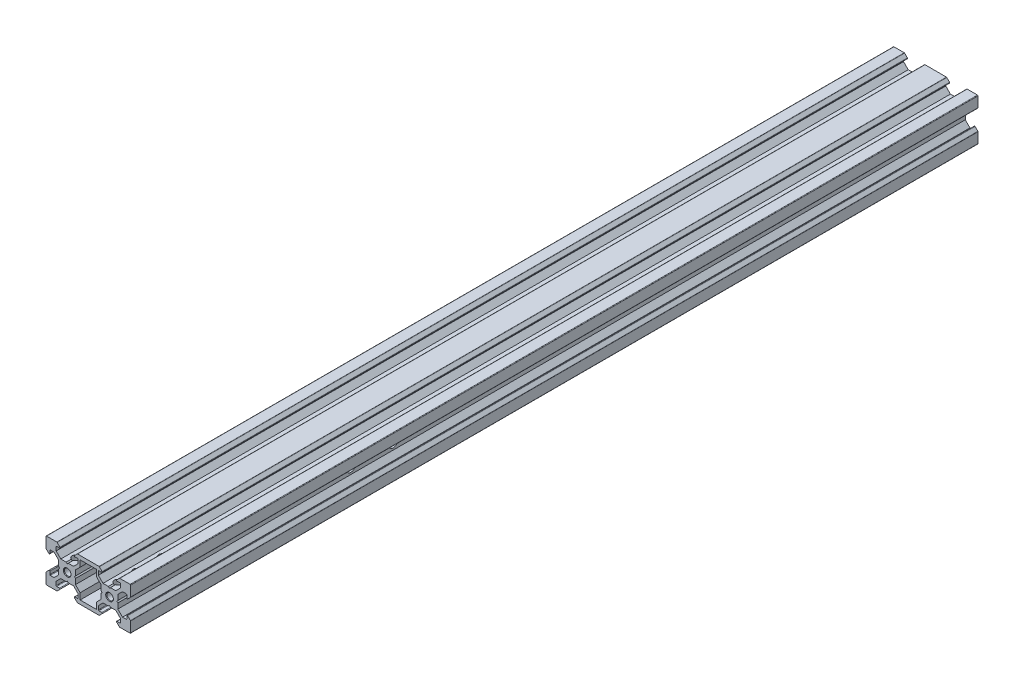
from build123d import *

# Parameters (mm, degrees)
SALIENTE_EXTRUIR1_DEPTH      = 200
SALIENTE_EXTRUIR1_DEPTH_BACK = 200
CROQUIS4_R                   = 1.569264143
CORTAR_EXTRUIR1_DEPTH        = 402.248052955
CHAFL_N1_SIZE                = 0.25
CROQUIS5_R                   = 1.65
CORTAR_EXTRUIR2_DEPTH        = 204.224014329
CROQUIS6_R                   = 2.1
CORTAR_EXTRUIR3_DEPTH        = 205.189567427


with BuildPart() as part:
    # Croquis1 → Saliente-Extruir1 (new, two sides: drawn at the far end of the back side and taken through both)
    with BuildSketch(Plane.XY.offset(-SALIENTE_EXTRUIR1_DEPTH_BACK)):
        with BuildLine():
            Line((-3.509619408, 8.626776695), (-4.809619408, 9.926776695))
            ThreePointArc((-4.809619408, 9.926776695), (-4.890725245, 9.980969883), (-4.986396103, 10))
            Line((-4.986396103, 10), (-15.096446609, 10))
            ThreePointArc((-15.096446609, 10), (-15.192117467, 9.980969883), (-15.273223305, 9.926776695))
            Line((-15.273223305, 9.926776695), (-16.573223305, 8.626776695))
            ThreePointArc((-16.573223305, 8.626776695), (-16.627416493, 8.354329142), (-16.396446609, 8.2))
            Line((-16.396446609, 8.2), (-15.039949494, 8.2))
            ThreePointArc((-15.039949494, 8.2), (-14.863172798, 8.126776695), (-14.789949494, 7.95))
            Line((-14.789949494, 7.95), (-14.789949494, 6.2))
            Line((-14.789949494, 6.2), (-16.989949494, 4))
            Line((-16.989949494, 4), (-19.5, 4))
            Line((-19.5, 4), (-20, 3.5))
            Line((-20, 3.5), (-20.5, 4))
            Line((-20.5, 4), (-23.010050506, 4))
            Line((-23.010050506, 4), (-25.210050506, 6.2))
            Line((-25.210050506, 6.2), (-25.210050506, 7.95))
            ThreePointArc((-25.210050506, 7.95), (-25.136827202, 8.126776695), (-24.960050506, 8.2))
            Line((-24.960050506, 8.2), (-23.603553391, 8.2))
            ThreePointArc((-23.603553391, 8.2), (-23.372583507, 8.354329142), (-23.426776695, 8.626776695))
            Line((-23.426776695, 8.626776695), (-24.726776695, 9.926776695))
            ThreePointArc((-24.726776695, 9.926776695), (-24.807882533, 9.980969883), (-24.903553391, 10))
            Line((-24.903553391, 10), (-29.75, 10))
            ThreePointArc((-29.75, 10), (-29.926776695, 9.926776695), (-30, 9.75))
            Line((-30, 9.75), (-30, 4.903553391))
            ThreePointArc((-30, 4.903553391), (-29.980969883, 4.807882533), (-29.926776695, 4.726776695))
            Line((-29.926776695, 4.726776695), (-28.626776695, 3.426776695))
            ThreePointArc((-28.626776695, 3.426776695), (-28.354329142, 3.372583507), (-28.2, 3.603553391))
            Line((-28.2, 3.603553391), (-28.2, 4.960050506))
            ThreePointArc((-28.2, 4.960050506), (-28.126776695, 5.136827202), (-27.95, 5.210050506))
            Line((-27.95, 5.210050506), (-26.2, 5.210050506))
            Line((-26.2, 5.210050506), (-24, 3.010050506))
            Line((-24, 3.010050506), (-24, 0.5))
            Line((-24, 0.5), (-23.5, 0))
            Line((-23.5, 0), (-24, -0.5))
            Line((-24, -0.5), (-24, -3.010050506))
            Line((-24, -3.010050506), (-26.2, -5.210050506))
            Line((-26.2, -5.210050506), (-27.95, -5.210050506))
            ThreePointArc((-27.95, -5.210050506), (-28.126776695, -5.136827202), (-28.2, -4.960050506))
            Line((-28.2, -4.960050506), (-28.2, -3.603553391))
            ThreePointArc((-28.2, -3.603553391), (-28.354329142, -3.372583507), (-28.626776695, -3.426776695))
            Line((-28.626776695, -3.426776695), (-29.926776695, -4.726776695))
            ThreePointArc((-29.926776695, -4.726776695), (-29.980969883, -4.807882533), (-30, -4.903553391))
            Line((-30, -4.903553391), (-30, -9.75))
            ThreePointArc((-30, -9.75), (-29.926776695, -9.926776695), (-29.75, -10))
            Line((-29.75, -10), (-24.903553391, -10))
            ThreePointArc((-24.903553391, -10), (-24.807882533, -9.980969883), (-24.726776695, -9.926776695))
            Line((-24.726776695, -9.926776695), (-23.426776695, -8.626776695))
            ThreePointArc((-23.426776695, -8.626776695), (-23.372583507, -8.354329142), (-23.603553391, -8.2))
            Line((-23.603553391, -8.2), (-24.960050506, -8.2))
            ThreePointArc((-24.960050506, -8.2), (-25.136827202, -8.126776695), (-25.210050506, -7.95))
            Line((-25.210050506, -7.95), (-25.210050506, -6.2))
            Line((-25.210050506, -6.2), (-23.010050506, -4))
            Line((-23.010050506, -4), (-20.5, -4))
            Line((-20.5, -4), (-20, -3.5))
            Line((-20, -3.5), (-19.5, -4))
            Line((-19.5, -4), (-16.989949494, -4))
            Line((-16.989949494, -4), (-14.789949494, -6.2))
            Line((-14.789949494, -6.2), (-14.789949494, -7.95))
            ThreePointArc((-14.789949494, -7.95), (-14.863172798, -8.126776695), (-15.039949494, -8.2))
            Line((-15.039949494, -8.2), (-16.396446609, -8.2))
            ThreePointArc((-16.396446609, -8.2), (-16.627416493, -8.354329142), (-16.573223305, -8.626776695))
            Line((-16.573223305, -8.626776695), (-15.273223305, -9.926776695))
            ThreePointArc((-15.273223305, -9.926776695), (-15.192117467, -9.980969883), (-15.096446609, -10))
            Line((-15.096446609, -10), (-4.986396103, -10))
            ThreePointArc((-4.986396103, -10), (-4.890725245, -9.980969883), (-4.809619408, -9.926776695))
            Line((-4.809619408, -9.926776695), (-3.509619408, -8.626776695))
            ThreePointArc((-3.509619408, -8.626776695), (-3.45542622, -8.354329142), (-3.686396103, -8.2))
            Line((-3.686396103, -8.2), (-5.042893219, -8.2))
            ThreePointArc((-5.042893219, -8.2), (-5.219669914, -8.126776695), (-5.292893219, -7.95))
            Line((-5.292893219, -7.95), (-5.292893219, -6.2))
            Line((-5.292893219, -6.2), (-3.092893219, -4))
            Line((-3.092893219, -4), (-0.582842712, -4))
            Line((-0.582842712, -4), (-0.082842712, -3.5))
            Line((-0.082842712, -3.5), (0.417157288, -4))
            Line((0.417157288, -4), (2.927207794, -4))
            Line((2.927207794, -4), (5.127207794, -6.2))
            Line((5.127207794, -6.2), (5.127207794, -7.95))
            ThreePointArc((5.127207794, -7.95), (5.053984489, -8.126776695), (4.877207794, -8.2))
            Line((4.877207794, -8.2), (3.520710678, -8.2))
            ThreePointArc((3.520710678, -8.2), (3.289740795, -8.354329142), (3.343933983, -8.626776695))
            Line((3.343933983, -8.626776695), (4.643933983, -9.926776695))
            ThreePointArc((4.643933983, -9.926776695), (4.72503982, -9.980969883), (4.820710678, -10))
            Line((4.820710678, -10), (9.667157288, -10))
            ThreePointArc((9.667157288, -10), (9.843933983, -9.926776695), (9.917157288, -9.75))
            Line((9.917157288, -9.75), (9.917157288, -4.903553391))
            ThreePointArc((9.917157288, -4.903553391), (9.898127171, -4.807882533), (9.843933983, -4.726776695))
            Line((9.843933983, -4.726776695), (8.543933983, -3.426776695))
            ThreePointArc((8.543933983, -3.426776695), (8.271486429, -3.372583507), (8.117157288, -3.603553391))
            Line((8.117157288, -3.603553391), (8.117157288, -4.960050506))
            ThreePointArc((8.117157288, -4.960050506), (8.043933983, -5.136827202), (7.867157288, -5.210050506))
            Line((7.867157288, -5.210050506), (6.117157288, -5.210050506))
            Line((6.117157288, -5.210050506), (3.917157288, -3.010050506))
            Line((3.917157288, -3.010050506), (3.917157288, -0.5))
            Line((3.917157288, -0.5), (3.417157288, 0))
            Line((3.417157288, 0), (3.917157288, 0.5))
            Line((3.917157288, 0.5), (3.917157288, 3.010050506))
            Line((3.917157288, 3.010050506), (6.117157288, 5.210050506))
            Line((6.117157288, 5.210050506), (7.867157288, 5.210050506))
            ThreePointArc((7.867157288, 5.210050506), (8.043933983, 5.136827202), (8.117157288, 4.960050506))
            Line((8.117157288, 4.960050506), (8.117157288, 3.603553391))
            ThreePointArc((8.117157288, 3.603553391), (8.271486429, 3.372583507), (8.543933983, 3.426776695))
            Line((8.543933983, 3.426776695), (9.843933983, 4.726776695))
            ThreePointArc((9.843933983, 4.726776695), (9.898127171, 4.807882533), (9.917157288, 4.903553391))
            Line((9.917157288, 4.903553391), (9.917157288, 9.75))
            ThreePointArc((9.917157288, 9.75), (9.843933983, 9.926776695), (9.667157288, 10))
            Line((9.667157288, 10), (4.820710678, 10))
            ThreePointArc((4.820710678, 10), (4.72503982, 9.980969883), (4.643933983, 9.926776695))
            Line((4.643933983, 9.926776695), (3.343933983, 8.626776695))
            ThreePointArc((3.343933983, 8.626776695), (3.289740795, 8.354329142), (3.520710678, 8.2))
            Line((3.520710678, 8.2), (4.877207794, 8.2))
            ThreePointArc((4.877207794, 8.2), (5.053984489, 8.126776695), (5.127207794, 7.95))
            Line((5.127207794, 7.95), (5.127207794, 6.2))
            Line((5.127207794, 6.2), (2.927207794, 4))
            Line((2.927207794, 4), (0.417157288, 4))
            Line((0.417157288, 4), (-0.082842712, 3.5))
            Line((-0.082842712, 3.5), (-0.582842712, 4))
            Line((-0.582842712, 4), (-3.092893219, 4))
            Line((-3.092893219, 4), (-5.292893219, 6.2))
            Line((-5.292893219, 6.2), (-5.292893219, 7.95))
            ThreePointArc((-5.292893219, 7.95), (-5.219669914, 8.126776695), (-5.042893219, 8.2))
            Line((-5.042893219, 8.2), (-3.686396103, 8.2))
            ThreePointArc((-3.686396103, 8.2), (-3.45542622, 8.354329142), (-3.509619408, 8.626776695))
        make_face()
        Polygon((-13.882842712, 5.210050506), (-13.882842712, 8.2), (-6.2, 8.2), (-6.2, 5.210050506), (-4, 3.010050506), (-4, 0.5), (-3.5, 0), (-4, -0.5), (-4, -3.010050506), (-6.2, -5.210050506), (-6.2, -8.2), (-13.882842712, -8.2), (-13.882842712, -5.210050506), (-16.082842712, -3.010050506), (-16.082842712, -0.5), (-16.582842712, 0), (-16.082842712, 0.5), (-16.082842712, 3.010050506), align=None, mode=Mode.SUBTRACT)
    extrude(amount=SALIENTE_EXTRUIR1_DEPTH + SALIENTE_EXTRUIR1_DEPTH_BACK)

    # Croquis4 → Cortar-Extruir1 (cut, through all)
    with BuildSketch(Plane.XY.offset(200)):
        with Locations((-20, 0)):
            Circle(CROQUIS4_R)
        Circle(CROQUIS4_R)
    extrude(amount=-CORTAR_EXTRUIR1_DEPTH, mode=Mode.SUBTRACT)

    # Chaflán1
    chafl_n1_edges = [part.edges().sort_by_distance(p)[0] for p in [
        (-21.569264143, 0, -200),
        (-1.569264143, 0, -200),
        (-1.569264143, 0, 200),
        (-21.569264143, 0, 200),
    ]]
    chamfer(chafl_n1_edges, length=CHAFL_N1_SIZE)

    # Croquis5 → Cortar-Extruir2 (cut, through all)
    with BuildSketch(Plane(origin=(0, 10, 0), x_dir=(1, 0, 0), z_dir=(0, 1, 0))):
        with Locations((-20, -196)):
            Circle(CROQUIS5_R)
        with Locations((-0.082842712, -196)):
            Circle(CROQUIS5_R)
        with Locations((-0.082842712, -187)):
            Circle(CROQUIS5_R)
        with Locations((-0.082842712, -175)):
            Circle(CROQUIS5_R)
    extrude(amount=-CORTAR_EXTRUIR2_DEPTH, mode=Mode.SUBTRACT)

    # Croquis6 → Cortar-Extruir3 (cut, through all)
    with BuildSketch(Plane(origin=(9.917157288, 0, 0), x_dir=(0, 0, -1), z_dir=(1, 0, 0))):
        with Locations((-90, 0)):
            Circle(CROQUIS6_R)
        with Locations((-70, 0)):
            Circle(CROQUIS6_R)
    extrude(amount=-CORTAR_EXTRUIR3_DEPTH, mode=Mode.SUBTRACT)


solid = part.part
